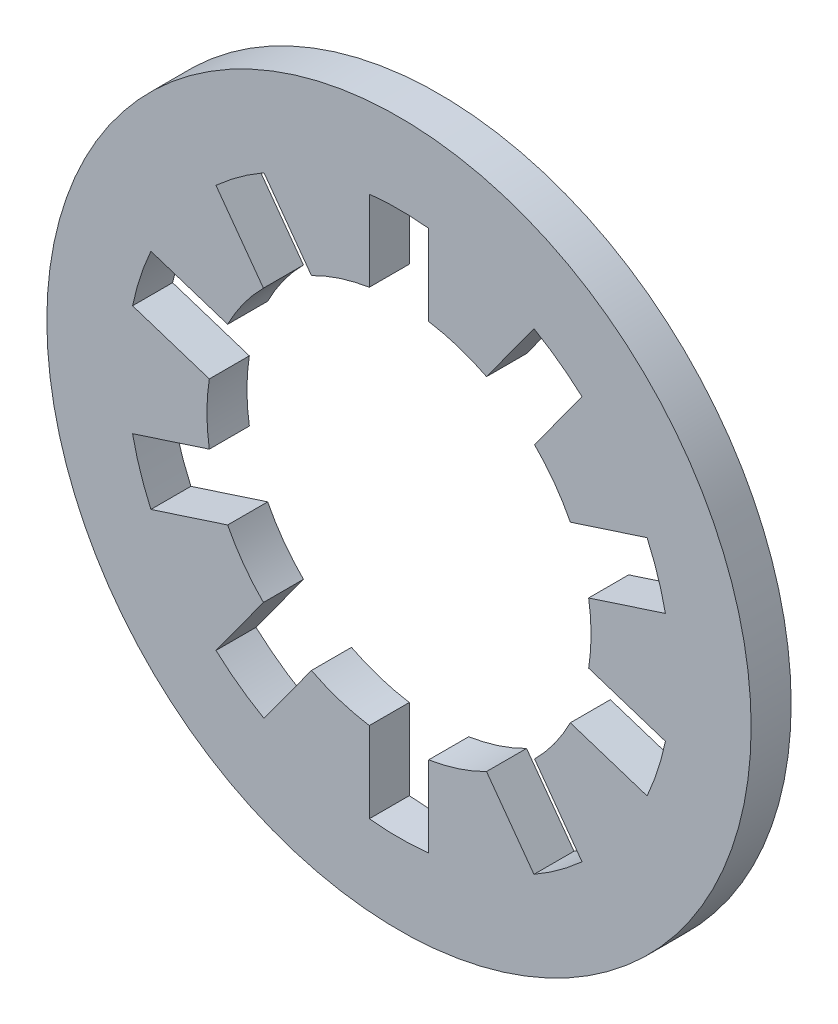
from build123d import *

# Parameters (mm, degrees)
SKETCH1_R          = 2.2
SKETCH1_R_2        = 1.2
EXTRUDE1_DEPTH     = 0.25
CUT_EXTRUDE1_DEPTH = 4.121297807
CIRPATTERN1_COUNT  = 10


with BuildPart() as part:
    # Sketch1 → Extrude1 (new body)
    with BuildSketch(Plane.XY):
        Circle(SKETCH1_R)
        Circle(SKETCH1_R_2, mode=Mode.SUBTRACT)
    extrude(amount=EXTRUDE1_DEPTH)

    # Sketch2 → Cut-Extrude1 (cut, through all)
    with BuildSketch(Plane.XY):
        with BuildLine():
            Line((-0.185410197, 1.689858887), (-0.185410197, 1.185589752))
            Line((-0.185410197, 1.185589752), (0.185410197, 1.185589752))
            Line((0.185410197, 1.185589752), (0.185410197, 1.689858887))
            ThreePointArc((0.185410197, 1.689858887), (0, 1.7), (-0.185410197, 1.689858887))
        make_face()
    cut_extrude1 = extrude(amount=CUT_EXTRUDE1_DEPTH, mode=Mode.SUBTRACT)

    # CirPattern1: Cut-Extrude1 ×10 about axis
    cirpattern1_axis = Axis((0, 0, 0), (0, 0, -1))
    for i in range(1, CIRPATTERN1_COUNT):
        add(cut_extrude1.rotate(cirpattern1_axis, i * 360 / CIRPATTERN1_COUNT), mode=Mode.SUBTRACT)


solid = part.part
